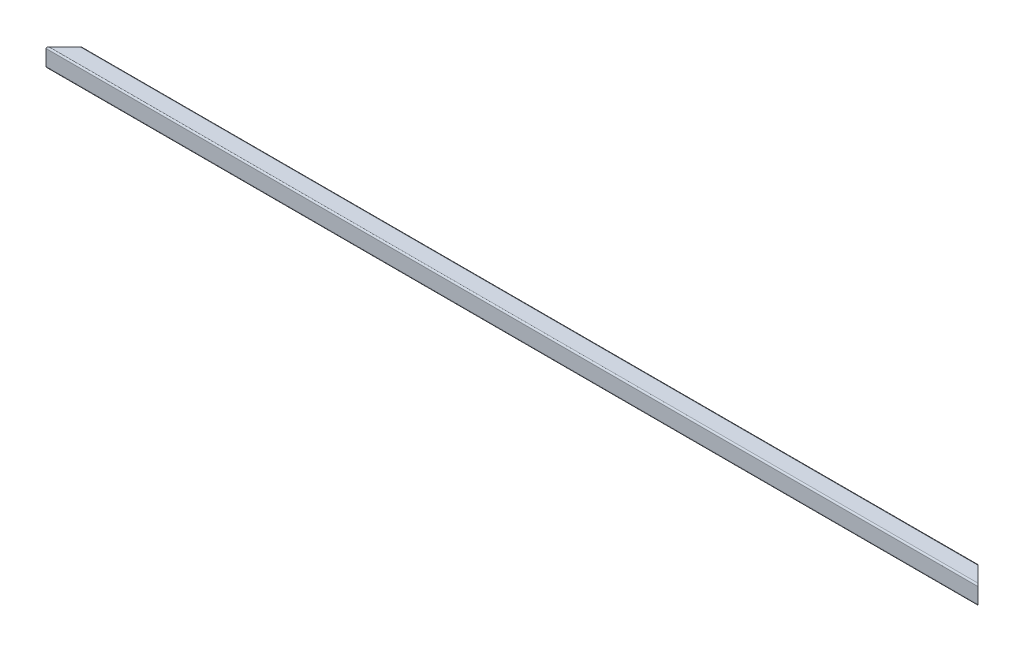
from build123d import *

# Parameters (mm, degrees)
SKETCH1_W           = 23.495
SKETCH1_H           = 23.495
BOSS_EXTRUDE1_DEPTH = 641.7872
SCALE1_SCALE_X      = 1
SCALE1_SCALE_Y      = 0.4
SCALE1_SCALE_Z      = 0.4
CUT_EXTRUDE1_DEPTH  = 643.297478466


with BuildPart() as part:
    # Sketch1 → Boss-Extrude1 (new body)
    with BuildSketch(Plane(origin=(0, 0, 0), x_dir=(0, 0, -1), z_dir=(1, 0, 0))):
        with BuildLine():
            Line((0, 2.54), (0, 29.21))
            ThreePointArc((0, 29.21), (-0.743948776, 31.006051224), (-2.54, 31.75))
            Line((-2.54, 31.75), (-29.21, 31.75))
            ThreePointArc((-29.21, 31.75), (-31.006051224, 31.006051224), (-31.75, 29.21))
            Line((-31.75, 29.21), (-31.75, 2.54))
            ThreePointArc((-31.75, 2.54), (-31.006051224, 0.743948776), (-29.21, 0))
            Line((-29.21, 0), (-2.54, 0))
            ThreePointArc((-2.54, 0), (-0.743948776, 0.743948776), (0, 2.54))
        make_face()
        with Locations((-15.875, 15.875)):
            Rectangle(SKETCH1_W, SKETCH1_H, mode=Mode.SUBTRACT)
    extrude(amount=BOSS_EXTRUDE1_DEPTH)


with BuildPart() as part_1:
    # Scale1: scaled about (320.8936, 15.875, 15.875)
    add(part.part.scale((SCALE1_SCALE_X, SCALE1_SCALE_Y, SCALE1_SCALE_Z), about=(320.8936, 15.875, 15.875)))

    # Sketch3 → Cut-Extrude1 (cut, through all)
    with BuildSketch(Plane(origin=(0, 22.225, 0), x_dir=(1, 0, 0), z_dir=(0, 1, 0))):
        Polygon((0, -9.525), (0, -22.225), (12.7, -9.525), align=None)
        Polygon((641.7872, -9.525), (641.7872, -22.225), (629.0872, -9.525), align=None)
    extrude(amount=-CUT_EXTRUDE1_DEPTH, mode=Mode.SUBTRACT)


solid = part_1.part
